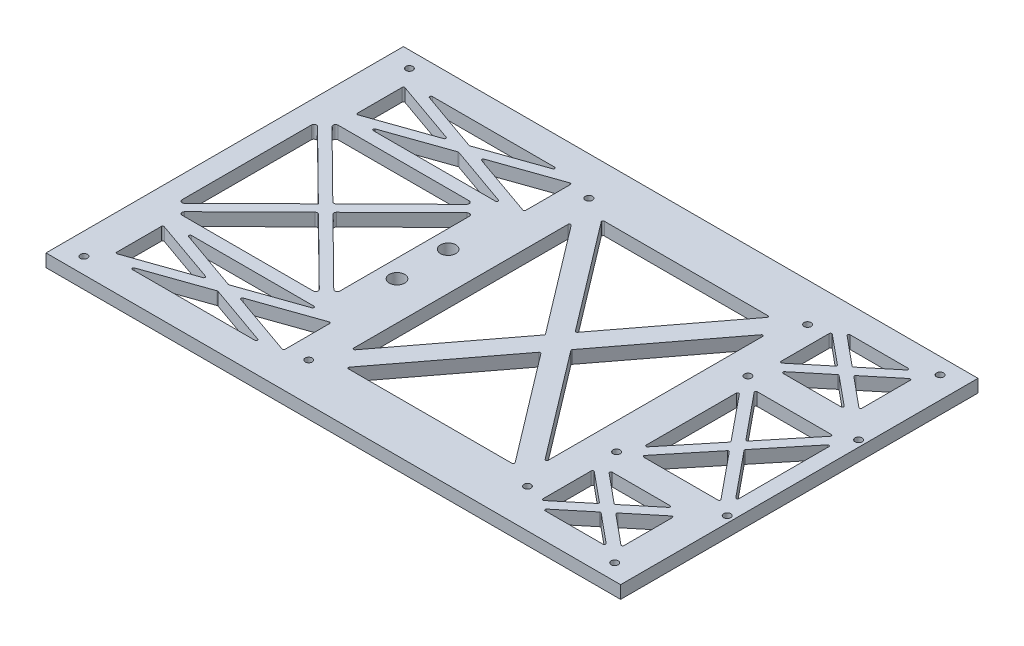
from build123d import *

# Parameters (mm, degrees)
SKETCH4_W                        = 224.59
SKETCH4_H                        = 139.7
TOPCHASSISBASE_DEPTH             = 5
BATTERYPACKMOUNTINGHOLESSKETCH_R = 1.375
BATTERYPACKMOUNTINGHOLES_DEPTH   = 7.5
F_9VBATTERYMOUNTINGHOLESSKETCH_R = 1.375
F_9VBATTERYMOUNTINGHOLES_DEPTH   = 7.5
DUALSWITCHMOUNTINGHOLESSKETCH_R  = 3
DUALSWITCHMOUNTINGHOLES_DEPTH    = 7.5
SKETCH5_R                        = 1.375
BOTTOMCHASSISMOUNTINGHOLES_DEPTH = 190.843843724
WEIGHTREDUCTION_DEPTH            = 190.843843724


with BuildPart() as part:
    # Sketch4 → topChassisBase (new body)
    with BuildSketch(Plane(origin=(0, 0, 0), x_dir=(1, 0, 0), z_dir=(0, 1, 0))):
        with Locations((27.955, 58)):
            Rectangle(SKETCH4_W, SKETCH4_H)
    extrude(amount=TOPCHASSISBASE_DEPTH)

    # batteryPackMountingHolesSketch → batteryPackMountingHoles (cut)
    with BuildSketch(Plane(origin=(0, 0, 0), x_dir=(1, 0, 0), z_dir=(0, 1, 0))):
        with Locations((3.25, 112.75)):
            Circle(BATTERYPACKMOUNTINGHOLESSKETCH_R)
        with Locations((3.25, 3.25)):
            Circle(BATTERYPACKMOUNTINGHOLESSKETCH_R)
        with Locations((88.75, 112.75)):
            Circle(BATTERYPACKMOUNTINGHOLESSKETCH_R)
        with Locations((88.75, 3.25)):
            Circle(BATTERYPACKMOUNTINGHOLESSKETCH_R)
    extrude(amount=BATTERYPACKMOUNTINGHOLES_DEPTH, mode=Mode.SUBTRACT)

    # 9VbatteryMountingHolesSketch → 9VbatteryMountingHoles (cut)
    with BuildSketch(Plane(origin=(0, 0, 0), x_dir=(1, 0, 0), z_dir=(0, 1, 0))):
        with Locations((94.5, 83.675)):
            Circle(F_9VBATTERYMOUNTINGHOLESSKETCH_R)
        with Locations((137.75, 83.675)):
            Circle(F_9VBATTERYMOUNTINGHOLESSKETCH_R)
        with Locations((94.5, 32.325)):
            Circle(F_9VBATTERYMOUNTINGHOLESSKETCH_R)
        with Locations((137.75, 32.325)):
            Circle(F_9VBATTERYMOUNTINGHOLESSKETCH_R)
    extrude(amount=F_9VBATTERYMOUNTINGHOLES_DEPTH, mode=Mode.SUBTRACT)

    # dualSwitchMountingHolesSketch → dualSwitchMountingHoles (cut)
    with BuildSketch(Plane(origin=(0, 0, 0), x_dir=(1, 0, 0), z_dir=(0, 1, 0))):
        with Locations((-7, 68)):
            Circle(DUALSWITCHMOUNTINGHOLESSKETCH_R)
        with Locations((-7, 48)):
            Circle(DUALSWITCHMOUNTINGHOLESSKETCH_R)
    extrude(amount=DUALSWITCHMOUNTINGHOLES_DEPTH, mode=Mode.SUBTRACT)

    # Sketch5 → bottomChassisMountingHoles (cut, through all)
    with BuildSketch(Plane(origin=(0, 5, 0), x_dir=(1, 0, 0), z_dir=(0, 1, 0))):
        with Locations((-75.7725, 121.6)):
            Circle(SKETCH5_R)
        with Locations((131.6825, 121.6)):
            Circle(SKETCH5_R)
        with Locations((-75.7725, -5.6)):
            Circle(SKETCH5_R)
        with Locations((131.6825, -5.6)):
            Circle(SKETCH5_R)
    extrude(amount=-BOTTOMCHASSISMOUNTINGHOLES_DEPTH, mode=Mode.SUBTRACT)

    # Sketch7 → weightReduction (cut, through all)
    with BuildSketch(Plane(origin=(0, 5, 0), x_dir=(1, 0, 0), z_dir=(0, 1, 0))):
        with BuildLine():
            Line((8.898081097, 100.207653938), (40.745966449, 58.302541634))
            ThreePointArc((40.745966449, 58.302541634), (40.847885351, 58), (40.745966449, 57.697458366))
            Line((40.745966449, 57.697458366), (8.898081097, 15.792346062))
            ThreePointArc((8.898081097, 15.792346062), (8.3403763, 15.621051992), (8, 16.094887695))
            Line((8, 16.094887695), (8, 99.905112305))
            ThreePointArc((8, 99.905112305), (8.3403763, 100.378948008), (8.898081097, 100.207653938))
        make_face()
        with BuildLine():
            Line((13.634033551, 8.802541634), (45.601918903, 50.865548675))
            ThreePointArc((45.601918903, 50.865548675), (46, 51.063007041), (46.398081097, 50.865548675))
            Line((46.398081097, 50.865548675), (78.365966449, 8.802541634))
            ThreePointArc((78.365966449, 8.802541634), (78.415808792, 8.277818562), (77.967885351, 8))
            Line((77.967885351, 8), (14.032114649, 8))
            ThreePointArc((14.032114649, 8), (13.584191208, 8.277818562), (13.634033551, 8.802541634))
        make_face()
        with BuildLine():
            Line((13.634033551, 107.197458366), (45.601918903, 65.134451325))
            ThreePointArc((45.601918903, 65.134451325), (46, 64.936992959), (46.398081097, 65.134451325))
            Line((46.398081097, 65.134451325), (78.365966449, 107.197458366))
            ThreePointArc((78.365966449, 107.197458366), (78.415808792, 107.722181438), (77.967885351, 108))
            Line((77.967885351, 108), (14.032114649, 108))
            ThreePointArc((14.032114649, 108), (13.584191208, 107.722181438), (13.634033551, 107.197458366))
        make_face()
        with BuildLine():
            Line((51.254033551, 57.697458366), (83.101918903, 15.792346062))
            ThreePointArc((83.101918903, 15.792346062), (83.6596237, 15.621051992), (84, 16.094887695))
            Line((84, 16.094887695), (84, 99.905112305))
            ThreePointArc((84, 99.905112305), (83.6596237, 100.378948008), (83.101918903, 100.207653938))
            Line((83.101918903, 100.207653938), (51.254033551, 58.302541634))
            ThreePointArc((51.254033551, 58.302541634), (51.152114649, 58), (51.254033551, 57.697458366))
        make_face()
        with BuildLine():
            Line((101.637535684, 80.175), (130.612464316, 80.175))
            ThreePointArc((130.612464316, 80.175), (131.064246542, 79.889226096), (130.999598487, 79.358571281))
            Line((130.999598487, 79.358571281), (116.51213417, 61.633908042))
            ThreePointArc((116.51213417, 61.633908042), (116.125, 61.450336761), (115.73786583, 61.633908042))
            Line((115.73786583, 61.633908042), (101.250401513, 79.358571281))
            ThreePointArc((101.250401513, 79.358571281), (101.185753458, 79.889226096), (101.637535684, 80.175))
        make_face()
        with BuildLine():
            Line((134.25, 75.612939101), (134.25, 40.387060899))
            ThreePointArc((134.25, 40.387060899), (133.91797755, 39.916121898), (133.36286583, 40.07063218))
            Line((133.36286583, 40.07063218), (118.966720566, 57.683571281))
            ThreePointArc((118.966720566, 57.683571281), (118.853854737, 58), (118.966720566, 58.316428719))
            Line((118.966720566, 58.316428719), (133.36286583, 75.92936782))
            ThreePointArc((133.36286583, 75.92936782), (133.91797755, 76.083878102), (134.25, 75.612939101))
        make_face()
        with BuildLine():
            Line((101.637535684, 35.825), (130.612464316, 35.825))
            ThreePointArc((130.612464316, 35.825), (131.064246542, 36.110773904), (130.999598487, 36.641428719))
            Line((130.999598487, 36.641428719), (116.51213417, 54.366091958))
            ThreePointArc((116.51213417, 54.366091958), (116.125, 54.549663239), (115.73786583, 54.366091958))
            Line((115.73786583, 54.366091958), (101.250401513, 36.641428719))
            ThreePointArc((101.250401513, 36.641428719), (101.185753458, 36.110773904), (101.637535684, 35.825))
        make_face()
        with BuildLine():
            Line((98, 75.612939101), (98, 40.387060899))
            ThreePointArc((98, 40.387060899), (98.33202245, 39.916121898), (98.88713417, 40.07063218))
            Line((98.88713417, 40.07063218), (113.283279434, 57.683571281))
            ThreePointArc((113.283279434, 57.683571281), (113.396145263, 58), (113.283279434, 58.316428719))
            Line((113.283279434, 58.316428719), (98.88713417, 75.92936782))
            ThreePointArc((98.88713417, 75.92936782), (98.33202245, 76.083878102), (98, 75.612939101))
        make_face()
        with BuildLine():
            Line((123.152140151, 117.6), (100.530359849, 117.6))
            ThreePointArc((100.530359849, 117.6), (100.05986385, 117.269214405), (100.211901047, 116.714534059))
            Line((100.211901047, 116.714534059), (111.522791198, 107.36986272))
            ThreePointArc((111.522791198, 107.36986272), (111.84125, 107.255328661), (112.159708802, 107.36986272))
            Line((112.159708802, 107.36986272), (123.470598953, 116.714534059))
            ThreePointArc((123.470598953, 116.714534059), (123.62263615, 117.269214405), (123.152140151, 117.6))
        make_face()
        with BuildLine():
            Line((96, 113.944088407), (96, 95.080911593))
            ThreePointArc((96, 95.080911593), (96.286961742, 94.628568028), (96.818458802, 94.695445652))
            Line((96.818458802, 94.695445652), (108.234554302, 104.127034059))
            ThreePointArc((108.234554302, 104.127034059), (108.4160955, 104.5125), (108.234554302, 104.897965941))
            Line((108.234554302, 104.897965941), (96.818458802, 114.329554348))
            ThreePointArc((96.818458802, 114.329554348), (96.286961742, 114.396431972), (96, 113.944088407))
        make_face()
        with BuildLine():
            Line((123.152140151, 91.425), (100.530359849, 91.425))
            ThreePointArc((100.530359849, 91.425), (100.05986385, 91.755785595), (100.211901047, 92.310465941))
            Line((100.211901047, 92.310465941), (111.522791198, 101.65513728))
            ThreePointArc((111.522791198, 101.65513728), (111.84125, 101.769671339), (112.159708802, 101.65513728))
            Line((112.159708802, 101.65513728), (123.470598953, 92.310465941))
            ThreePointArc((123.470598953, 92.310465941), (123.62263615, 91.755785595), (123.152140151, 91.425))
        make_face()
        with BuildLine():
            Line((127.6825, 113.944088407), (127.6825, 95.080911593))
            ThreePointArc((127.6825, 95.080911593), (127.395538258, 94.628568028), (126.864041198, 94.695445652))
            Line((126.864041198, 94.695445652), (115.447945698, 104.127034059))
            ThreePointArc((115.447945698, 104.127034059), (115.2664045, 104.5125), (115.447945698, 104.897965941))
            Line((115.447945698, 104.897965941), (126.864041198, 114.329554348))
            ThreePointArc((126.864041198, 114.329554348), (127.395538258, 114.396431972), (127.6825, 113.944088407))
        make_face()
        with BuildLine():
            Line((115.447945698, 11.102034059), (126.864041198, 1.670445652))
            ThreePointArc((126.864041198, 1.670445652), (127.395538258, 1.603568028), (127.6825, 2.055911593))
            Line((127.6825, 2.055911593), (127.6825, 20.919088407))
            ThreePointArc((127.6825, 20.919088407), (127.395538258, 21.371431972), (126.864041198, 21.304554348))
            Line((126.864041198, 21.304554348), (115.447945698, 11.872965941))
            ThreePointArc((115.447945698, 11.872965941), (115.2664045, 11.4875), (115.447945698, 11.102034059))
        make_face()
        with BuildLine():
            Line((100.211901047, 23.689534059), (111.522791198, 14.34486272))
            ThreePointArc((111.522791198, 14.34486272), (111.84125, 14.230328661), (112.159708802, 14.34486272))
            Line((112.159708802, 14.34486272), (123.470598953, 23.689534059))
            ThreePointArc((123.470598953, 23.689534059), (123.62263615, 24.244214405), (123.152140151, 24.575))
            Line((123.152140151, 24.575), (100.530359849, 24.575))
            ThreePointArc((100.530359849, 24.575), (100.05986385, 24.244214405), (100.211901047, 23.689534059))
        make_face()
        with BuildLine():
            Line((96.818458802, 1.670445652), (108.234554302, 11.102034059))
            ThreePointArc((108.234554302, 11.102034059), (108.4160955, 11.4875), (108.234554302, 11.872965941))
            Line((108.234554302, 11.872965941), (96.818458802, 21.304554348))
            ThreePointArc((96.818458802, 21.304554348), (96.286961742, 21.371431972), (96, 20.919088407))
            Line((96, 20.919088407), (96, 2.055911593))
            ThreePointArc((96, 2.055911593), (96.286961742, 1.603568028), (96.818458802, 1.670445652))
        make_face()
        with BuildLine():
            Line((123.152140151, -1.6), (100.530359849, -1.6))
            ThreePointArc((100.530359849, -1.6), (100.05986385, -1.269214405), (100.211901047, -0.714534059))
            Line((100.211901047, -0.714534059), (111.522791198, 8.63013728))
            ThreePointArc((111.522791198, 8.63013728), (111.84125, 8.744671339), (112.159708802, 8.63013728))
            Line((112.159708802, 8.63013728), (123.470598953, -0.714534059))
            ThreePointArc((123.470598953, -0.714534059), (123.62263615, -1.269214405), (123.152140151, -1.6))
        make_face()
        with BuildLine():
            Line((-5, 2.225309174), (-5, 19.674690826))
            ThreePointArc((-5, 19.674690826), (-5.210899627, 20.082638095), (-5.665683898, 20.146441656))
            Line((-5.665683898, 20.146441656), (-30.507446986, 11.42175083))
            ThreePointArc((-30.507446986, 11.42175083), (-30.841763088, 10.95), (-30.507446986, 10.47824917))
            Line((-30.507446986, 10.47824917), (-5.665683898, 1.753558344))
            ThreePointArc((-5.665683898, 1.753558344), (-5.210899627, 1.817361905), (-5, 2.225309174))
        make_face()
        with BuildLine():
            Line((-61.804365902, 22.5), (-13.968134098, 22.5))
            ThreePointArc((-13.968134098, 22.5), (-13.475246984, 22.084037446), (-13.8024502, 21.52824917))
            Line((-13.8024502, 21.52824917), (-37.720566102, 13.127953038))
            ThreePointArc((-37.720566102, 13.127953038), (-37.88625, 13.099703868), (-38.051933898, 13.127953038))
            Line((-38.051933898, 13.127953038), (-61.9700498, 21.52824917))
            ThreePointArc((-61.9700498, 21.52824917), (-62.297253016, 22.084037446), (-61.804365902, 22.5))
        make_face()
        with BuildLine():
            Line((-70.7725, 2.225309174), (-70.7725, 19.674690826))
            ThreePointArc((-70.7725, 19.674690826), (-70.561600373, 20.082638095), (-70.106816102, 20.146441656))
            Line((-70.106816102, 20.146441656), (-45.265053014, 11.42175083))
            ThreePointArc((-45.265053014, 11.42175083), (-44.930736912, 10.95), (-45.265053014, 10.47824917))
            Line((-45.265053014, 10.47824917), (-70.106816102, 1.753558344))
            ThreePointArc((-70.106816102, 1.753558344), (-70.561600373, 1.817361905), (-70.7725, 2.225309174))
        make_face()
        with BuildLine():
            Line((-61.804365902, -0.6), (-13.968134098, -0.6))
            ThreePointArc((-13.968134098, -0.6), (-13.475246984, -0.184037446), (-13.8024502, 0.37175083))
            Line((-13.8024502, 0.37175083), (-37.720566102, 8.772046962))
            ThreePointArc((-37.720566102, 8.772046962), (-37.88625, 8.800296132), (-38.051933898, 8.772046962))
            Line((-38.051933898, 8.772046962), (-61.9700498, 0.37175083))
            ThreePointArc((-61.9700498, 0.37175083), (-62.297253016, -0.184037446), (-61.804365902, -0.6))
        make_face()
        with BuildLine():
            Line((-61.9700498, 115.62824917), (-38.051933898, 107.227953038))
            ThreePointArc((-38.051933898, 107.227953038), (-37.88625, 107.199703868), (-37.720566102, 107.227953038))
            Line((-37.720566102, 107.227953038), (-13.8024502, 115.62824917))
            ThreePointArc((-13.8024502, 115.62824917), (-13.475246984, 116.184037446), (-13.968134098, 116.6))
            Line((-13.968134098, 116.6), (-61.804365902, 116.6))
            ThreePointArc((-61.804365902, 116.6), (-62.297253016, 116.184037446), (-61.9700498, 115.62824917))
        make_face()
        with BuildLine():
            Line((-30.507446986, 104.57824917), (-5.665683898, 95.853558344))
            ThreePointArc((-5.665683898, 95.853558344), (-5.210899627, 95.917361905), (-5, 96.325309174))
            Line((-5, 96.325309174), (-5, 113.774690826))
            ThreePointArc((-5, 113.774690826), (-5.210899627, 114.182638095), (-5.665683898, 114.246441656))
            Line((-5.665683898, 114.246441656), (-30.507446986, 105.52175083))
            ThreePointArc((-30.507446986, 105.52175083), (-30.841763088, 105.05), (-30.507446986, 104.57824917))
        make_face()
        with BuildLine():
            Line((-61.9700498, 94.47175083), (-38.051933898, 102.872046962))
            ThreePointArc((-38.051933898, 102.872046962), (-37.88625, 102.900296132), (-37.720566102, 102.872046962))
            Line((-37.720566102, 102.872046962), (-13.8024502, 94.47175083))
            ThreePointArc((-13.8024502, 94.47175083), (-13.475246984, 93.915962554), (-13.968134098, 93.5))
            Line((-13.968134098, 93.5), (-61.804365902, 93.5))
            ThreePointArc((-61.804365902, 93.5), (-62.297253016, 93.915962554), (-61.9700498, 94.47175083))
        make_face()
        with BuildLine():
            Line((-70.106816102, 114.246441656), (-45.265053014, 105.52175083))
            ThreePointArc((-45.265053014, 105.52175083), (-44.930736912, 105.05), (-45.265053014, 104.57824917))
            Line((-45.265053014, 104.57824917), (-70.106816102, 95.853558344))
            ThreePointArc((-70.106816102, 95.853558344), (-70.561600373, 95.917361905), (-70.7725, 96.325309174))
            Line((-70.7725, 96.325309174), (-70.7725, 113.774690826))
            ThreePointArc((-70.7725, 113.774690826), (-70.561600373, 114.182638095), (-70.106816102, 114.246441656))
        make_face()
        with BuildLine():
            Line((-18.579609732, 86.788458099), (-44.183606333, 61.504653936))
            ThreePointArc((-44.183606333, 61.504653936), (-44.88625, 61.216195837), (-45.588893667, 61.504653936))
            Line((-45.588893667, 61.504653936), (-71.192890268, 86.788458099))
            ThreePointArc((-71.192890268, 86.788458099), (-71.41532549, 87.879774999), (-70.490246601, 88.5))
            Line((-70.490246601, 88.5), (-19.282253399, 88.5))
            ThreePointArc((-19.282253399, 88.5), (-18.35717451, 87.879774999), (-18.579609732, 86.788458099))
        make_face()
        with BuildLine():
            Line((-74.069856333, 84.007851629), (-47.732642976, 58))
            Line((-47.732642976, 58), (-74.069856333, 31.992148371))
            ThreePointArc((-74.069856333, 31.992148371), (-75.158088078, 31.78101924), (-75.7725, 32.703690272))
            Line((-75.7725, 32.703690272), (-75.7725, 83.296309728))
            ThreePointArc((-75.7725, 83.296309728), (-75.158088078, 84.21898076), (-74.069856333, 84.007851629))
        make_face()
        with BuildLine():
            Line((-15.702643667, 84.007851629), (-41.319304203, 58.711541901))
            ThreePointArc((-41.319304203, 58.711541901), (-41.616660535, 58), (-41.319304203, 57.288458099))
            Line((-41.319304203, 57.288458099), (-15.702643667, 31.992148371))
            ThreePointArc((-15.702643667, 31.992148371), (-14.614411922, 31.78101924), (-14, 32.703690272))
            Line((-14, 32.703690272), (-14, 83.296309728))
            ThreePointArc((-14, 83.296309728), (-14.614411922, 84.21898076), (-15.702643667, 84.007851629))
        make_face()
        with BuildLine():
            Line((-70.490246601, 27.5), (-19.282253399, 27.5))
            ThreePointArc((-19.282253399, 27.5), (-18.35717451, 28.120225001), (-18.579609732, 29.211541901))
            Line((-18.579609732, 29.211541901), (-44.183606333, 54.495346064))
            ThreePointArc((-44.183606333, 54.495346064), (-44.88625, 54.783804163), (-45.588893667, 54.495346064))
            Line((-45.588893667, 54.495346064), (-71.192890268, 29.211541901))
            ThreePointArc((-71.192890268, 29.211541901), (-71.41532549, 28.120225001), (-70.490246601, 27.5))
        make_face()
    extrude(amount=-WEIGHTREDUCTION_DEPTH, mode=Mode.SUBTRACT)


solid = part.part
